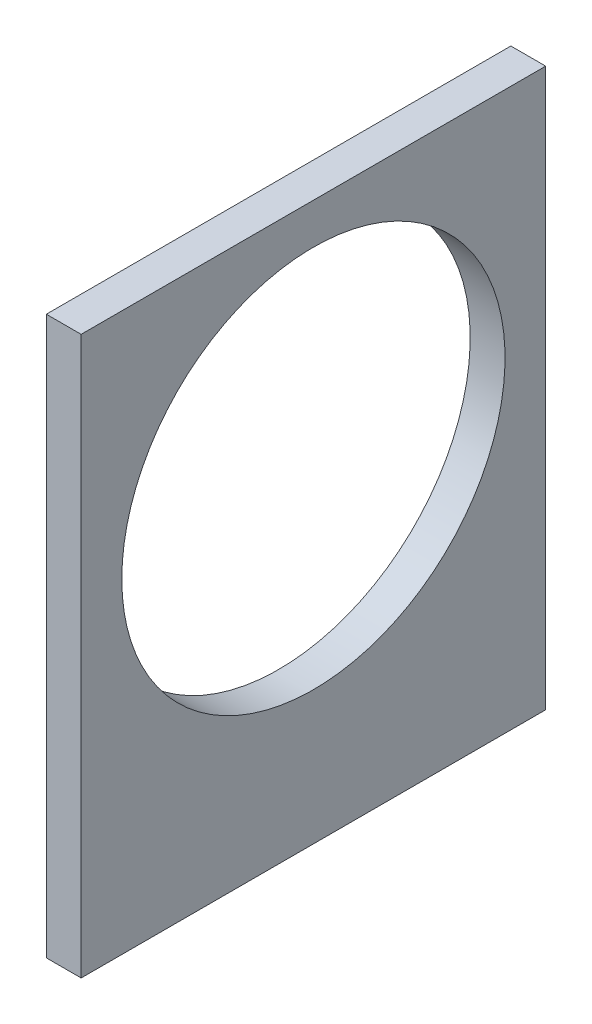
from build123d import *

# Parameters (mm, degrees)
SKETCH4_W                     = 63.5
SKETCH4_H                     = 76.2
SKETCH4_R                     = 26.19375
BOSS_EXTRUDE2_DEPTH           = 4.7625
TAP_DRILL_FOR_6_32_TAP1_D     = 2.7051
TAP_DRILL_FOR_6_32_TAP1_DEPTH = 12.7
TAP_DRILL_FOR_6_32_TAP1_TIP   = 0.81269403


with BuildPart() as part:
    # Sketch4 → Boss-Extrude2 (new body)
    with BuildSketch(Plane(origin=(0, 0, 0), x_dir=(0, 0, -1), z_dir=(1, 0, 0))):
        Rectangle(SKETCH4_W, SKETCH4_H)
        with Locations((0, 6.35)):
            Circle(SKETCH4_R, mode=Mode.SUBTRACT)
    extrude(amount=BOSS_EXTRUDE2_DEPTH)

    # Tap Drill for #6-32 Tap1
    with Locations(Plane(origin=(0, -38.1, 0), x_dir=(-1, 0, 0), z_dir=(0, -1, 0))):
        with Locations((-2.38125, 29.36875), (-2.38125, -29.36875)):
            Hole(TAP_DRILL_FOR_6_32_TAP1_D / 2, depth=TAP_DRILL_FOR_6_32_TAP1_DEPTH)
            with Locations((0, 0, -(TAP_DRILL_FOR_6_32_TAP1_DEPTH + TAP_DRILL_FOR_6_32_TAP1_TIP / 2))):  # 118° drill point
                Cone(0, TAP_DRILL_FOR_6_32_TAP1_D / 2, TAP_DRILL_FOR_6_32_TAP1_TIP, mode=Mode.SUBTRACT)


solid = part.part
